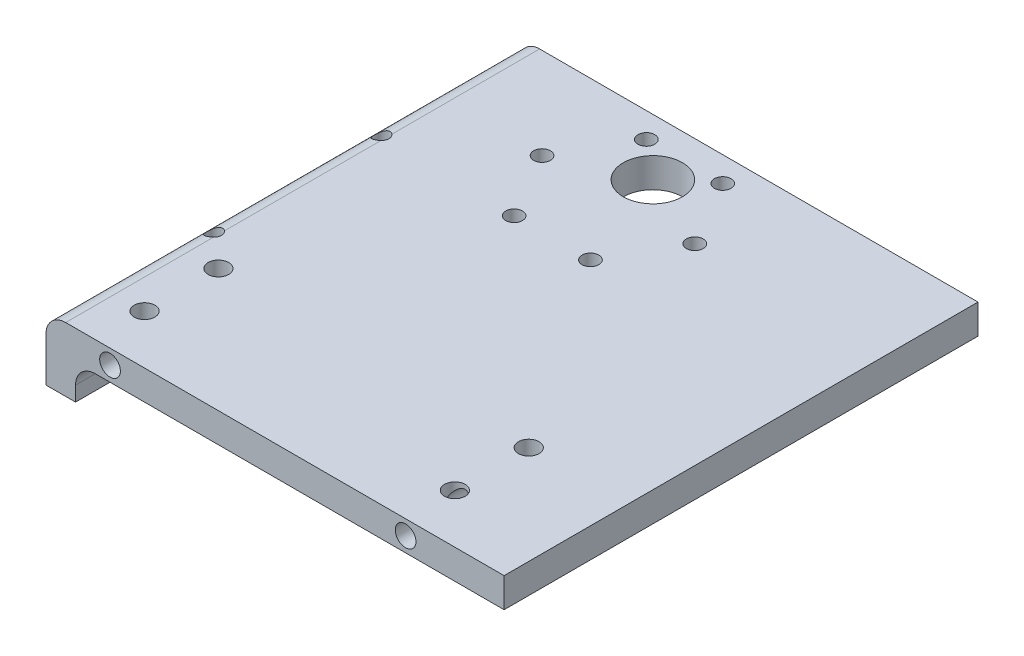
from build123d import *

# Parameters (mm, degrees)
SKETCH1_W           = 93
SKETCH1_H           = 96.2019
SKETCH1_R           = 6
SKETCH1_R_2         = 1.7
SKETCH1_R_3         = 2.1
BOSS_EXTRUDE1_DEPTH = 6
SKETCH2_W           = 6
SKETCH2_H           = 96.2019
SKETCH2_R           = 1.5
BOSS_EXTRUDE2_DEPTH = 7
SKETCH2_3_R         = 1.5
CUT_EXTRUDE2_DEPTH  = 134.988079931
FILLET1_R           = 4
SKETCH3_R           = 2.1
CUT_EXTRUDE3_DEPTH  = 18
CUT_EXTRUDE4_START  = -78.2019
SKETCH3_2_R         = 2.1
CUT_EXTRUDE4_DEPTH  = 18


with BuildPart() as part:
    # Sketch1 → Boss-Extrude1 (new body)
    with BuildSketch(Plane(origin=(0, 0, 0), x_dir=(-1, 0, 0), z_dir=(0, 1, 0))):
        with Locations((46.5, 48.10095)):
            Rectangle(SKETCH1_W, SKETCH1_H)
        with Locations(Location((54.5, 11.5, 0), (0, 0, 90))):
            Circle(SKETCH1_R, mode=Mode.SUBTRACT)
        with Locations(Location((39, 18.5, 0), (0, 0, 90))):
            Circle(SKETCH1_R_2, mode=Mode.SUBTRACT)
        with Locations(Location((46.75, 31.923393759, 0), (0, 0, 90))):
            Circle(SKETCH1_R_2, mode=Mode.SUBTRACT)
        with Locations(Location((62.25, 31.923393759, 0), (0, 0, 90))):
            Circle(SKETCH1_R_2, mode=Mode.SUBTRACT)
        with Locations(Location((70, 18.5, 0), (0, 0, 90))):
            Circle(SKETCH1_R_2, mode=Mode.SUBTRACT)
        with Locations(Location((62.25, 5.076606241, 0), (0, 0, 90))):
            Circle(SKETCH1_R_2, mode=Mode.SUBTRACT)
        with Locations(Location((46.75, 5.076606241, 0), (0, 0, 90))):
            Circle(SKETCH1_R_2, mode=Mode.SUBTRACT)
        with Locations(Location((20, 86.2019, 0), (0, 0, 90))):
            Circle(SKETCH1_R_3, mode=Mode.SUBTRACT)
        with Locations(Location((83, 86.2019, 0), (0, 0, 90))):
            Circle(SKETCH1_R_3, mode=Mode.SUBTRACT)
        with Locations(Location((83, 71.2019, 0), (0, 0, 90))):
            Circle(SKETCH1_R_3, mode=Mode.SUBTRACT)
        with Locations(Location((20, 71.2019, 0), (0, 0, 90))):
            Circle(SKETCH1_R_3, mode=Mode.SUBTRACT)
    extrude(amount=BOSS_EXTRUDE1_DEPTH)

    # Sketch2 → Boss-Extrude2 (add)
    with BuildSketch(Plane(origin=(0, 0, 0), x_dir=(-1, 0, 0), z_dir=(0, -1, 0))):
        with Locations((90, -48.10095)):
            Rectangle(SKETCH2_W, SKETCH2_H)
        with Locations(Location((90, -65.10095, 0), (0, 0, 90))):
            Circle(SKETCH2_R, mode=Mode.SUBTRACT)
        with Locations(Location((90, -31.10095, 0), (0, 0, 90))):
            Circle(SKETCH2_R, mode=Mode.SUBTRACT)
    extrude(amount=BOSS_EXTRUDE2_DEPTH)

    # Sketch2<3> → Cut-Extrude2 (cut, through all)
    with BuildSketch(Plane(origin=(0, 0, 0), x_dir=(-1, 0, 0), z_dir=(0, -1, 0))):
        with Locations(Location((90, -31.10095, 0), (0, 0, 90))):
            Circle(SKETCH2_3_R)
        with Locations(Location((90, -65.10095, 0), (0, 0, 90))):
            Circle(SKETCH2_3_R)
    extrude(amount=-CUT_EXTRUDE2_DEPTH, mode=Mode.SUBTRACT)

    # Fillet1
    # the kernel refuses this fillet: 4 mm, written as the material it adds along each edge
    with BuildSketch(Plane(origin=(-87, 0, 96.2019), x_dir=(0, -1, 0), z_dir=(0, 0, -1))) as fillet1_piece_1_section:
        with BuildLine():
            CenterArc((FILLET1_R, -FILLET1_R), FILLET1_R, 90, 90)
            Line((0, -FILLET1_R), (0, 0))
            Line((0, 0), (FILLET1_R, 0))
        make_face()
    fillet1_piece_1 = extrude(amount=96.2019, mode=Mode.PRIVATE)
    fillet1_piece_1 = fillet1_piece_1 - Plane(origin=(-83, -0.912137569, 71.2019), x_dir=(0, 0, 1), z_dir=(0, -1, 0)) * Cylinder(2.1, 209, mode=Mode.PRIVATE)
    fillet1_piece_1 = fillet1_piece_1 - Plane(origin=(-83, -0.912137569, 86.2019), x_dir=(0, 0, 1), z_dir=(0, -1, 0)) * Cylinder(2.1, 209, mode=Mode.PRIVATE)
    add(fillet1_piece_1)
    # the kernel refuses this fillet: 4 mm, written as the material it takes off along each edge
    with BuildSketch(Plane(origin=(-93, 6, -10), x_dir=(1, 0, 0), z_dir=(0, 0, 1))) as fillet1_2_piece_1:
        with BuildLine():
            CenterArc((FILLET1_R, -FILLET1_R), FILLET1_R, 90, 90)
            Line((0, -FILLET1_R), (0, 0))
            Line((0, 0), (FILLET1_R, 0))
        make_face()
    extrude(amount=116.2019, mode=Mode.SUBTRACT)

    # Sketch3 → Cut-Extrude3 (cut)
    with BuildSketch(Plane(origin=(0, 0, 0), x_dir=(1, 0, 0), z_dir=(0, 0, -1))):
        with Locations(Location((-80, -3, 0), (0, 0, 180))):
            Circle(SKETCH3_R)
        with Locations(Location((-20, -3, 0), (0, 0, 180))):
            Circle(SKETCH3_R)
    extrude(amount=-CUT_EXTRUDE3_DEPTH, mode=Mode.SUBTRACT)

    # Sketch3<2> → Cut-Extrude4 (cut)
    with BuildSketch(Plane(origin=(0, 0, 0), x_dir=(1, 0, 0), z_dir=(0, 0, -1)).offset(CUT_EXTRUDE4_START)):
        with Locations(Location((-80, -3, 0), (0, 0, 180))):
            Circle(SKETCH3_2_R)
        with Locations(Location((-20, -3, 0), (0, 0, 180))):
            Circle(SKETCH3_2_R)
    extrude(amount=-CUT_EXTRUDE4_DEPTH, mode=Mode.SUBTRACT)


solid = part.part
